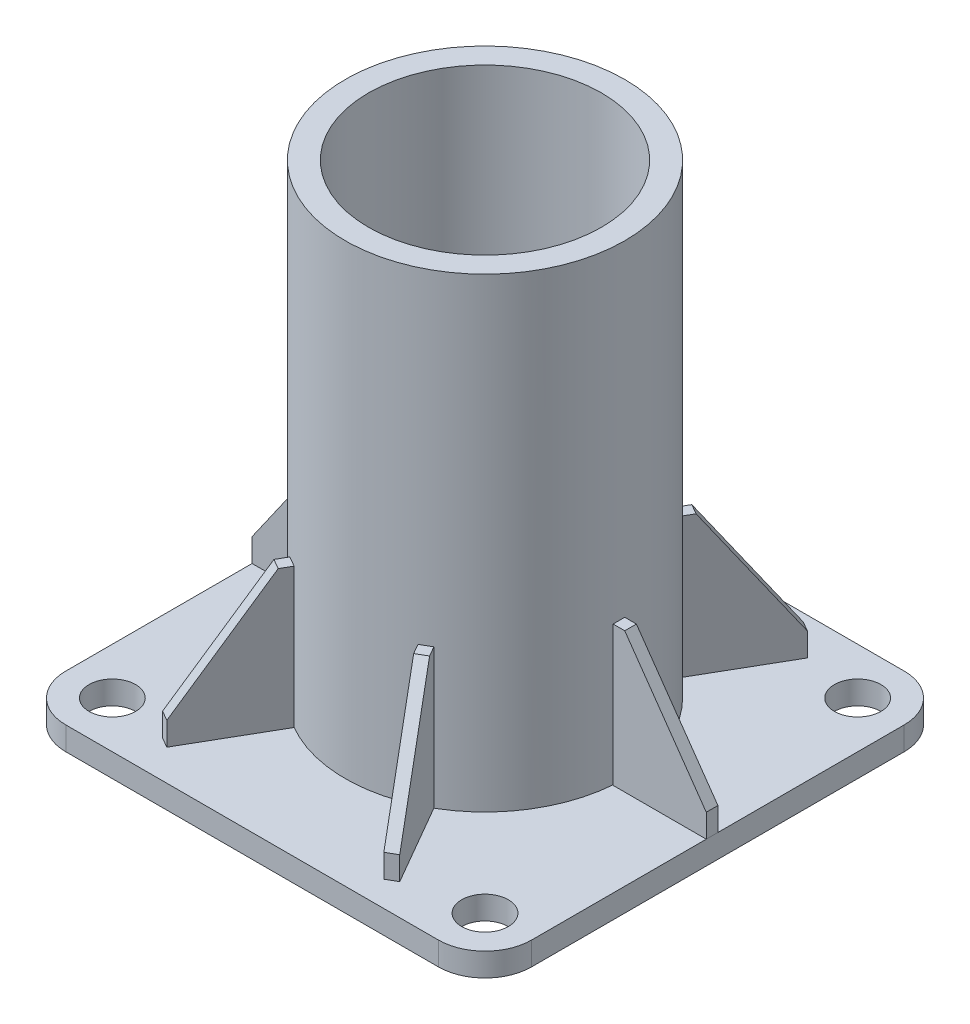
from build123d import *

# Parameters (mm, degrees)
SKETCH1_R           = 10
BOSS_EXTRUDE1_DEPTH = 10
SKETCH2_R           = 60
SKETCH2_R_2         = 50
EXTRUDE_THIN1_DEPTH = 200
GUSSET1_START       = 2.109678302
GUSSET1_DEPTH       = 5
CIRPATTERN1_COUNT   = 6


# Read off the part's stored shape, not the designer's step: Gusset1
with BuildPart() as part:
    # Sketch1 → Boss-Extrude1 (new body)
    with BuildSketch(Plane(origin=(0, 0, 0), x_dir=(1, 0, 0), z_dir=(0, 1, 0))):
        with BuildLine():
            Line((-136.692913386, 92.890321698), (23.307086614, 92.890321698))
            ThreePointArc((23.307086614, 92.890321698), (37.449222238, 87.032457321), (43.307086614, 72.890321698))
            Line((43.307086614, 72.890321698), (43.307086614, -87.109678302))
            ThreePointArc((43.307086614, -87.109678302), (37.449222238, -101.251813926), (23.307086614, -107.109678302))
            Line((23.307086614, -107.109678302), (-136.692913386, -107.109678302))
            ThreePointArc((-136.692913386, -107.109678302), (-150.83504901, -101.251813926), (-156.692913386, -87.109678302))
            Line((-156.692913386, -87.109678302), (-156.692913386, 72.890321698))
            ThreePointArc((-156.692913386, 72.890321698), (-150.83504901, 87.032457321), (-136.692913386, 92.890321698))
        make_face()
        with Locations(Location((-136.692913386, 72.890321698, 0), (0, 0, 270))):
            Circle(SKETCH1_R, mode=Mode.SUBTRACT)
        with Locations(Location((-136.692913386, -87.109678302, 0), (0, 0, 270))):
            Circle(SKETCH1_R, mode=Mode.SUBTRACT)
        with Locations(Location((23.307086614, -87.109678302, 0), (0, 0, 270))):
            Circle(SKETCH1_R, mode=Mode.SUBTRACT)
        with Locations(Location((23.307086614, 72.890321698, 0), (0, 0, 270))):
            Circle(SKETCH1_R, mode=Mode.SUBTRACT)
    extrude(amount=BOSS_EXTRUDE1_DEPTH)

    # Sketch2 → Extrude-Thin1 (add)
    with BuildSketch(Plane(origin=(0, 10, 0), x_dir=(1, 0, 0), z_dir=(0, 1, 0))):
        with Locations((-56.692913386, -7.109678302)):
            Circle(SKETCH2_R)
        with Locations((-56.692913386, -7.109678302)):
            Circle(SKETCH2_R_2, mode=Mode.SUBTRACT)
    extrude(amount=EXTRUDE_THIN1_DEPTH)


with BuildPart() as body_2:
    # Gusset1 outline → Gusset1 (new body)
    with BuildSketch(Plane.XY.offset(GUSSET1_START)):
        Polygon((-116.692913386, 70), (-121.692913386, 70), (-156.692913386, 20.014819764), (-156.692913386, 10), (-116.692913386, 10), align=None)
    extrude(amount=GUSSET1_DEPTH)


with BuildPart() as cirpattern1_1:
    # CirPattern1: pattern copy
    add(body_2.part.rotate(Axis((-56.692913386, 0, 7.109678302), (0, 1, 0)), 1 * 360 / CIRPATTERN1_COUNT))


with BuildPart() as cirpattern1_2:
    # CirPattern1: pattern copy
    add(body_2.part.rotate(Axis((-56.692913386, 0, 7.109678302), (0, 1, 0)), 2 * 360 / CIRPATTERN1_COUNT))


with BuildPart() as cirpattern1_3:
    # CirPattern1: pattern copy
    add(body_2.part.rotate(Axis((-56.692913386, 0, 7.109678302), (0, 1, 0)), 3 * 360 / CIRPATTERN1_COUNT))


with BuildPart() as cirpattern1_4:
    # CirPattern1: pattern copy
    add(body_2.part.rotate(Axis((-56.692913386, 0, 7.109678302), (0, 1, 0)), 4 * 360 / CIRPATTERN1_COUNT))


with BuildPart() as cirpattern1_5:
    # CirPattern1: pattern copy
    add(body_2.part.rotate(Axis((-56.692913386, 0, 7.109678302), (0, 1, 0)), 5 * 360 / CIRPATTERN1_COUNT))


solid = Compound([part.part, body_2.part, cirpattern1_1.part, cirpattern1_2.part, cirpattern1_3.part, cirpattern1_4.part, cirpattern1_5.part])
